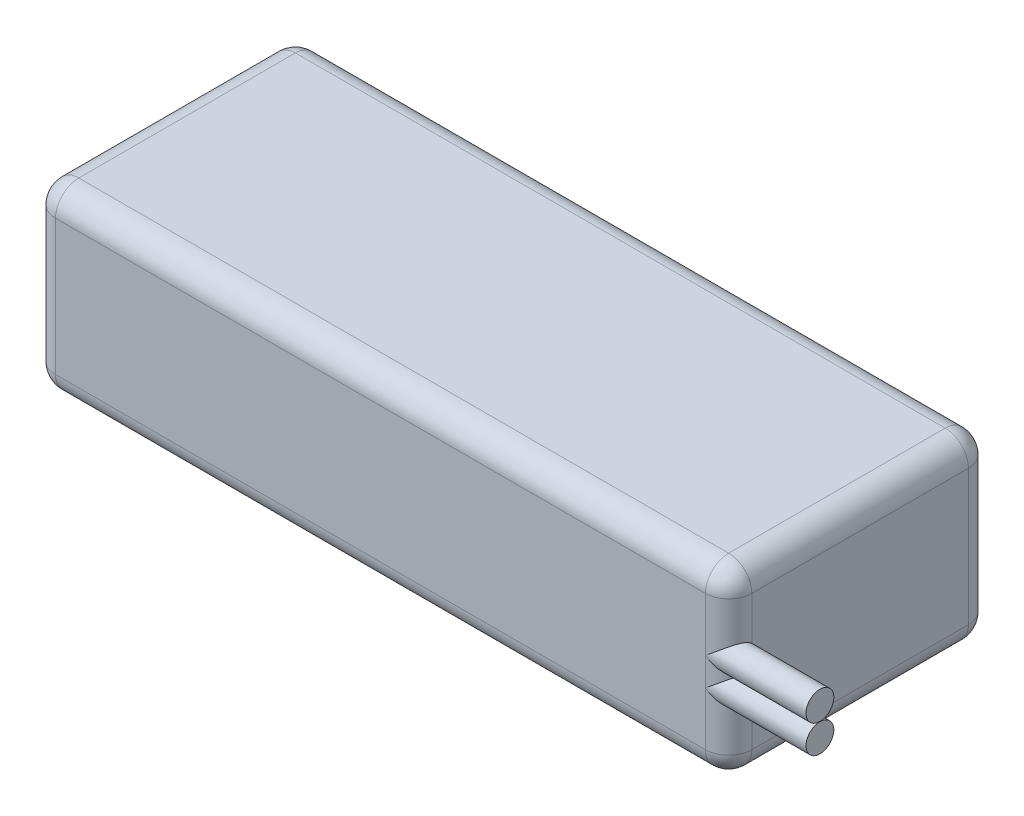
from build123d import *

# Parameters (mm, degrees)
SKETCH1_W           = 90
SKETCH1_H           = 34
BOSS_EXTRUDE1_DEPTH = 23.5
SKETCH2_R           = 1.8
BOSS_EXTRUDE4_DEPTH = 10
FILLET1_R           = 3


with BuildPart() as part:
    # Sketch1 → Boss-Extrude1 (new body)
    with BuildSketch(Plane(origin=(0, 0, 0), x_dir=(1, 0, 0), z_dir=(0, 1, 0))):
        with Locations((2.348643006, -1.686847599)):
            Rectangle(SKETCH1_W, SKETCH1_H)
    extrude(amount=BOSS_EXTRUDE1_DEPTH)

    # Sketch2 → Boss-Extrude4 (add)
    with BuildSketch(Plane(origin=(47.348643006, 0, 0), x_dir=(0, 0, -1), z_dir=(1, 0, 0))):
        with Locations(Location((-16.886847599, 13.57, 0), (0, 0, 180))):
            Circle(SKETCH2_R)
        with Locations(Location((-16.886847599, 9.93, 0), (0, 0, 180))):
            Circle(SKETCH2_R)
    extrude(amount=BOSS_EXTRUDE4_DEPTH)

    # Fillet1
    # the kernel refuses this fillet: 3 mm, written as the material it takes off along each edge
    with BuildSketch(Plane(origin=(44.348643006, 20.5, -12.313152401), x_dir=(1, 0, 0), z_dir=(0, 0, -1))) as fillet1_piece_1_section:
        Polygon((0, 0), (FILLET1_R * 1.02, 0), (FILLET1_R * 1.02, -FILLET1_R * 1.02), (0, -FILLET1_R * 1.02), align=None)
    fillet1_piece_1 = extrude(amount=FILLET1_R * 1.02, mode=Mode.PRIVATE)
    fillet1_piece_1 = fillet1_piece_1 - Plane(origin=(44.348643006, 20.5, -12.313152401), x_dir=(-0.7071067811865475, -0.7071067811865475, 0), z_dir=(0, 0, -1)) * Sphere(FILLET1_R, mode=Mode.PRIVATE)
    add(fillet1_piece_1, mode=Mode.SUBTRACT)
    with BuildSketch(Plane(origin=(44.348643006, 20.5, 15.686847599), x_dir=(0, 1, 0), z_dir=(1, 0, 0))) as fillet1_piece_2_section:
        Polygon((0, 0), (FILLET1_R * 1.02, 0), (FILLET1_R * 1.02, FILLET1_R * 1.02), (0, FILLET1_R * 1.02), align=None)
    fillet1_piece_2 = extrude(amount=FILLET1_R * 1.02, mode=Mode.PRIVATE)
    fillet1_piece_2 = fillet1_piece_2 - Plane(origin=(44.348643006, 20.5, 15.686847599), x_dir=(0, -0.7071067811865475, -0.7071067811865475), z_dir=(1, 0, 0)) * Sphere(FILLET1_R, mode=Mode.PRIVATE)
    add(fillet1_piece_2, mode=Mode.SUBTRACT)
    with BuildSketch(Plane(origin=(-39.651356994, 20.5, -12.313152401), x_dir=(-1, 0, 0), z_dir=(0, 0, -1))) as fillet1_piece_3_section:
        Polygon((0, 0), (FILLET1_R * 1.02, 0), (FILLET1_R * 1.02, FILLET1_R * 1.02), (0, FILLET1_R * 1.02), align=None)
    fillet1_piece_3 = extrude(amount=FILLET1_R * 1.02, mode=Mode.PRIVATE)
    fillet1_piece_3 = fillet1_piece_3 - Plane(origin=(-39.651356994, 20.5, -12.313152401), x_dir=(0.7071067811865475, -0.7071067811865475, 0), z_dir=(0, 0, -1)) * Sphere(FILLET1_R, mode=Mode.PRIVATE)
    add(fillet1_piece_3, mode=Mode.SUBTRACT)
    with BuildSketch(Plane(origin=(44.348643006, 3, 15.686847599), x_dir=(0, -1, 0), z_dir=(1, 0, 0))) as fillet1_piece_4_section:
        Polygon((0, 0), (FILLET1_R * 1.02, 0), (FILLET1_R * 1.02, -FILLET1_R * 1.02), (0, -FILLET1_R * 1.02), align=None)
    fillet1_piece_4 = extrude(amount=FILLET1_R * 1.02, mode=Mode.PRIVATE)
    fillet1_piece_4 = fillet1_piece_4 - Plane(origin=(44.348643006, 3, 15.686847599), x_dir=(0, 0.7071067811865475, -0.7071067811865475), z_dir=(1, 0, 0)) * Sphere(FILLET1_R, mode=Mode.PRIVATE)
    add(fillet1_piece_4, mode=Mode.SUBTRACT)
    with BuildSketch(Plane(origin=(-39.651356994, 20.5, 15.686847599), x_dir=(0, 1, 0), z_dir=(-1, 0, 0))) as fillet1_piece_5_section:
        Polygon((0, 0), (FILLET1_R * 1.02, 0), (FILLET1_R * 1.02, -FILLET1_R * 1.02), (0, -FILLET1_R * 1.02), align=None)
    fillet1_piece_5 = extrude(amount=FILLET1_R * 1.02, mode=Mode.PRIVATE)
    fillet1_piece_5 = fillet1_piece_5 - Plane(origin=(-39.651356994, 20.5, 15.686847599), x_dir=(0, -0.7071067811865475, -0.7071067811865475), z_dir=(-1, 0, 0)) * Sphere(FILLET1_R, mode=Mode.PRIVATE)
    add(fillet1_piece_5, mode=Mode.SUBTRACT)
    with BuildSketch(Plane(origin=(-39.651356994, 3, -12.313152401), x_dir=(-1, 0, 0), z_dir=(0, 0, -1))) as fillet1_piece_6_section:
        Polygon((0, 0), (FILLET1_R * 1.02, 0), (FILLET1_R * 1.02, -FILLET1_R * 1.02), (0, -FILLET1_R * 1.02), align=None)
    fillet1_piece_6 = extrude(amount=FILLET1_R * 1.02, mode=Mode.PRIVATE)
    fillet1_piece_6 = fillet1_piece_6 - Plane(origin=(-39.651356994, 3, -12.313152401), x_dir=(0.7071067811865475, 0.7071067811865475, 0), z_dir=(0, 0, -1)) * Sphere(FILLET1_R, mode=Mode.PRIVATE)
    add(fillet1_piece_6, mode=Mode.SUBTRACT)
    with BuildSketch(Plane(origin=(44.348643006, 3, -12.313152401), x_dir=(1, 0, 0), z_dir=(0, 0, -1))) as fillet1_piece_7_section:
        Polygon((0, 0), (FILLET1_R * 1.02, 0), (FILLET1_R * 1.02, FILLET1_R * 1.02), (0, FILLET1_R * 1.02), align=None)
    fillet1_piece_7 = extrude(amount=FILLET1_R * 1.02, mode=Mode.PRIVATE)
    fillet1_piece_7 = fillet1_piece_7 - Plane(origin=(44.348643006, 3, -12.313152401), x_dir=(-0.7071067811865475, 0.7071067811865475, 0), z_dir=(0, 0, -1)) * Sphere(FILLET1_R, mode=Mode.PRIVATE)
    add(fillet1_piece_7, mode=Mode.SUBTRACT)
    with BuildSketch(Plane(origin=(-39.651356994, 3, 15.686847599), x_dir=(0, -1, 0), z_dir=(-1, 0, 0))) as fillet1_piece_8_section:
        Polygon((0, 0), (FILLET1_R * 1.02, 0), (FILLET1_R * 1.02, FILLET1_R * 1.02), (0, FILLET1_R * 1.02), align=None)
    fillet1_piece_8 = extrude(amount=FILLET1_R * 1.02, mode=Mode.PRIVATE)
    fillet1_piece_8 = fillet1_piece_8 - Plane(origin=(-39.651356994, 3, 15.686847599), x_dir=(0, 0.7071067811865475, -0.7071067811865475), z_dir=(-1, 0, 0)) * Sphere(FILLET1_R, mode=Mode.PRIVATE)
    add(fillet1_piece_8, mode=Mode.SUBTRACT)
    with BuildSketch(Plane(origin=(47.348643006, 23.5, -12.313152401), x_dir=(0, -1, 0), z_dir=(0, 0, 1)), Plane(origin=(-42.651356994, 23.5, 15.686847599), x_dir=(0, -1, 0), z_dir=(0, 0, -1))) as fillet1_piece_9:
        with BuildLine():
            CenterArc((FILLET1_R, -FILLET1_R), FILLET1_R, 90, 90)
            Line((0, -FILLET1_R), (0, 0))
            Line((0, 0), (FILLET1_R, 0))
        make_face()
    extrude(amount=28, mode=Mode.SUBTRACT)
    with BuildSketch(Plane(origin=(-39.651356994, 23.5, -15.313152401), x_dir=(0, -1, 0), z_dir=(1, 0, 0)), Plane(origin=(44.348643006, 0, 18.686847599), x_dir=(0, 0, -1), z_dir=(-1, 0, 0))) as fillet1_piece_10:
        with BuildLine():
            CenterArc((FILLET1_R, -FILLET1_R), FILLET1_R, 90, 90)
            Line((0, -FILLET1_R), (0, 0))
            Line((0, 0), (FILLET1_R, 0))
        make_face()
    extrude(amount=84, mode=Mode.SUBTRACT)
    with BuildSketch(Plane(origin=(47.348643006, 9.93, 18.686847599), x_dir=(0, 0, -1), z_dir=(0, 1, 0))) as fillet1_piece_11_section:
        with BuildLine():
            CenterArc((FILLET1_R, FILLET1_R), FILLET1_R, 180, 90)
            Line((0, FILLET1_R), (0, 0))
            Line((0, 0), (FILLET1_R, 0))
        make_face()
    fillet1_piece_11 = extrude(amount=3.64, mode=Mode.PRIVATE)
    fillet1_piece_11 = fillet1_piece_11 - Plane(origin=(46.419832721, 13.57, 16.886847599), x_dir=(0, 0, 1), z_dir=(-1, 0, 0)) * Cylinder(1.8, 20, mode=Mode.PRIVATE)
    fillet1_piece_11 = fillet1_piece_11 - Plane(origin=(46.419832721, 9.93, 16.886847599), x_dir=(0, 0, 1), z_dir=(-1, 0, 0)) * Cylinder(1.8, 20, mode=Mode.PRIVATE)
    add(fillet1_piece_11, mode=Mode.SUBTRACT)
    with BuildSketch(Plane(origin=(47.348643006, 3, 18.686847599), x_dir=(0, 0, -1), z_dir=(0, 1, 0))) as fillet1_piece_12_section:
        with BuildLine():
            CenterArc((FILLET1_R, FILLET1_R), FILLET1_R, 180, 90)
            Line((0, FILLET1_R), (0, 0))
            Line((0, 0), (FILLET1_R, 0))
        make_face()
    fillet1_piece_12 = extrude(amount=6.93, mode=Mode.PRIVATE)
    fillet1_piece_12 = fillet1_piece_12 - Plane(origin=(46.65046867, 9.93, 16.886847599), x_dir=(0, 0, 1), z_dir=(-1, 0, 0)) * Cylinder(1.8, 26, mode=Mode.PRIVATE)
    add(fillet1_piece_12, mode=Mode.SUBTRACT)
    with BuildSketch(Plane(origin=(-39.651356994, 0, -15.313152401), x_dir=(0, 1, 0), z_dir=(1, 0, 0)), Plane(origin=(44.348643006, 23.5, 18.686847599), x_dir=(0, 0, -1), z_dir=(-1, 0, 0))) as fillet1_piece_13:
        with BuildLine():
            CenterArc((FILLET1_R, FILLET1_R), FILLET1_R, 180, 90)
            Line((0, FILLET1_R), (0, 0))
            Line((0, 0), (FILLET1_R, 0))
        make_face()
    extrude(amount=84, mode=Mode.SUBTRACT)
    with BuildSketch(Plane(origin=(47.348643006, 0, -12.313152401), x_dir=(0, 1, 0), z_dir=(0, 0, 1)), Plane(origin=(-42.651356994, 0, 15.686847599), x_dir=(0, 1, 0), z_dir=(0, 0, -1))) as fillet1_piece_14:
        with BuildLine():
            CenterArc((FILLET1_R, FILLET1_R), FILLET1_R, 180, 90)
            Line((0, FILLET1_R), (0, 0))
            Line((0, 0), (FILLET1_R, 0))
        make_face()
    extrude(amount=28, mode=Mode.SUBTRACT)
    with BuildSketch(Plane(origin=(-42.651356994, 3, -15.313152401), x_dir=(1, 0, 0), z_dir=(0, 1, 0)), Plane(origin=(-42.651356994, 3, 18.686847599), x_dir=(0, 0, -1), z_dir=(0, 1, 0))) as fillet1_piece_15:
        with BuildLine():
            CenterArc((FILLET1_R, -FILLET1_R), FILLET1_R, 90, 90)
            Line((0, -FILLET1_R), (0, 0))
            Line((0, 0), (FILLET1_R, 0))
        make_face()
    extrude(amount=17.5, mode=Mode.SUBTRACT)
    with BuildSketch(Plane(origin=(47.348643006, 3, -15.313152401), x_dir=(-1, 0, 0), z_dir=(0, 1, 0))) as fillet1_piece_16:
        with BuildLine():
            CenterArc((FILLET1_R, FILLET1_R), FILLET1_R, 180, 90)
            Line((0, FILLET1_R), (0, 0))
            Line((0, 0), (FILLET1_R, 0))
        make_face()
    extrude(amount=17.5, mode=Mode.SUBTRACT)
    with BuildSketch(Plane(origin=(47.348643006, 13.57, 18.686847599), x_dir=(0, 0, -1), z_dir=(0, 1, 0))) as fillet1_piece_17_section:
        with BuildLine():
            CenterArc((FILLET1_R, FILLET1_R), FILLET1_R, 180, 90)
            Line((0, FILLET1_R), (0, 0))
            Line((0, 0), (FILLET1_R, 0))
        make_face()
    fillet1_piece_17 = extrude(amount=6.93, mode=Mode.PRIVATE)
    fillet1_piece_17 = fillet1_piece_17 - Plane(origin=(46.65046859, 13.57, 16.886847599), x_dir=(0, 0, 1), z_dir=(-1, 0, 0)) * Cylinder(1.8, 26, mode=Mode.PRIVATE)
    add(fillet1_piece_17, mode=Mode.SUBTRACT)


solid = part.part
